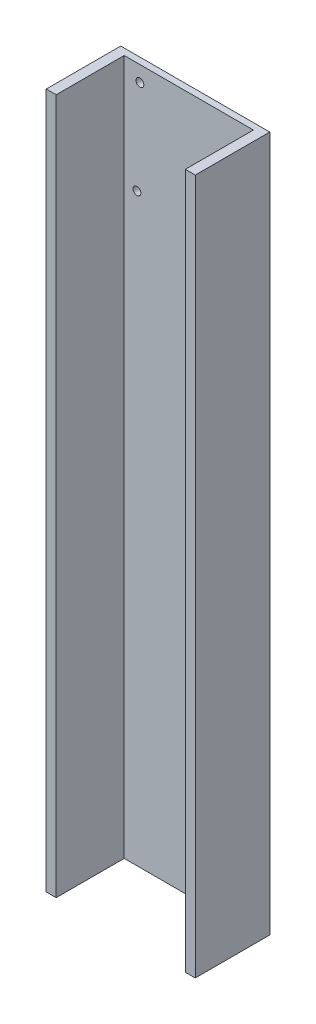
from build123d import *

# Parameters (mm, degrees)
BOSS_EXTRUDE1_DEPTH = 177.8
SKETCH2_R           = 2
CUT_EXTRUDE1_DEPTH  = 186.13603324


with BuildPart() as part:
    # Sketch1 → Boss-Extrude1 (new, symmetric)
    with BuildSketch(Plane(origin=(0, 0, 0), x_dir=(1, 0, 0), z_dir=(0, 1, 0))):
        Polygon((-38.1, -19.05), (-33.02, -19.05), (-33.02, 15.748), (33.02, 15.748), (33.02, -19.05), (38.1, -19.05), (38.1, 19.05), (-38.1, 19.05), align=None)
    extrude(amount=BOSS_EXTRUDE1_DEPTH, both=True)

    # Sketch2 → Cut-Extrude1 (cut, through all)
    with BuildSketch(Plane.XY.offset(-15.748)):
        with Locations((-25.02, 169.8)):
            Circle(SKETCH2_R)
        with Locations((-26.52, 121.033493779)):
            Circle(SKETCH2_R)
    extrude(amount=-CUT_EXTRUDE1_DEPTH, mode=Mode.SUBTRACT)


solid = part.part
